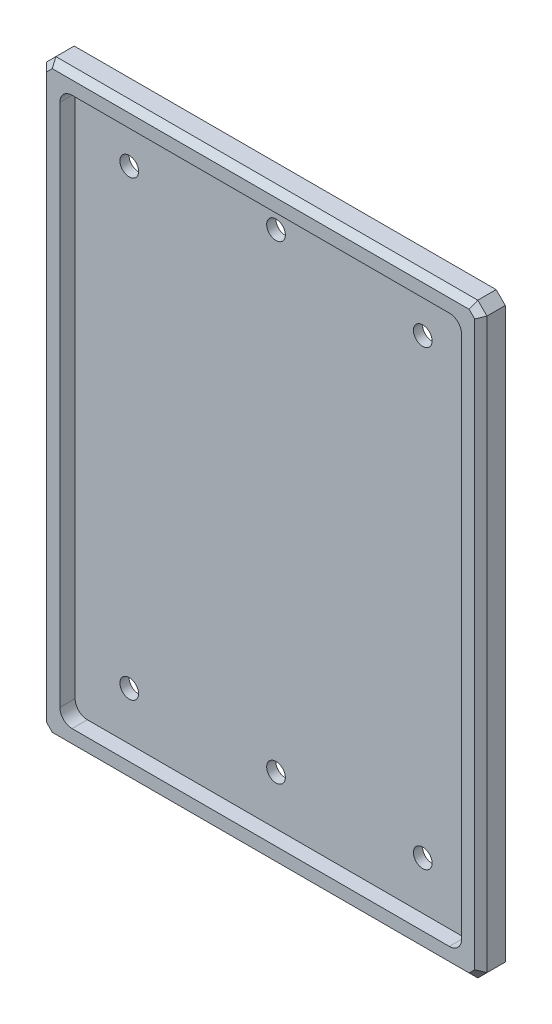
from build123d import *

# Parameters (mm, degrees)
SKETCH1_W                 = 228.6
SKETCH1_H                 = 304.8
BOSS_EXTRUDE1_DEPTH       = 12.7
CUT_EXTRUDE1_DEPTH        = 7.9375
SKETCH4_R                 = 4.85
CUT_EXTRUDE2_DEPTH        = 191.665292873
M4X0_7_TAPPED_HOLE1_D     = 3.3
M4X0_7_TAPPED_HOLE1_DEPTH = 5.4
M4X0_7_TAPPED_HOLE1_TIP   = 0.991420021
CHAMFER1_SIZE             = 4.7625
CHAMFER2_SIZE             = 3.175


with BuildPart() as part:
    # Sketch1 → Boss-Extrude1 (new body)
    with BuildSketch(Plane.XY):
        Rectangle(SKETCH1_W, SKETCH1_H)
    extrude(amount=BOSS_EXTRUDE1_DEPTH)

    # Sketch2 → Cut-Extrude1 (cut)
    with BuildSketch(Plane.XY.offset(12.7)):
        with BuildLine():
            Line((97.95, -142.4), (-97.95, -142.4))
            ThreePointArc((-97.95, -142.4), (-102.440128061, -140.540128061), (-104.3, -136.05))
            Line((-104.3, -136.05), (-104.3, 136.05))
            ThreePointArc((-104.3, 136.05), (-102.440128061, 140.540128061), (-97.95, 142.4))
            Line((-97.95, 142.4), (97.95, 142.4))
            ThreePointArc((97.95, 142.4), (102.440128061, 140.540128061), (104.3, 136.05))
            Line((104.3, 136.05), (104.3, -136.05))
            ThreePointArc((104.3, -136.05), (102.440128061, -140.540128061), (97.95, -142.4))
        make_face()
    extrude(amount=-CUT_EXTRUDE1_DEPTH, mode=Mode.SUBTRACT)

    # Sketch4 → Cut-Extrude2 (cut, through all)
    with BuildSketch(Plane.XY.offset(4.7625)):
        with Locations((-76.2, 117.4)):
            Circle(SKETCH4_R)
        with Locations((76.2, 117.4)):
            Circle(SKETCH4_R)
        with Locations((-76.2, -117.4)):
            Circle(SKETCH4_R)
        with Locations((76.2, -117.4)):
            Circle(SKETCH4_R)
        with Locations((0, 126.925)):
            Circle(SKETCH4_R)
        with Locations((0, -117)):
            Circle(SKETCH4_R)
    extrude(amount=-CUT_EXTRUDE2_DEPTH, mode=Mode.SUBTRACT)

    # M4x0.7 Tapped Hole1
    with Locations(Plane(origin=(0, 0, 0), x_dir=(-1, 0, 0), z_dir=(0, 0, -1))):
        with Locations((-111.125, -102.4), (-111.125, 0), (-111.125, 113.6)):
            Hole(M4X0_7_TAPPED_HOLE1_D / 2, depth=M4X0_7_TAPPED_HOLE1_DEPTH)
            with Locations((0, 0, -(M4X0_7_TAPPED_HOLE1_DEPTH + M4X0_7_TAPPED_HOLE1_TIP / 2))):  # 118° drill point
                Cone(0, M4X0_7_TAPPED_HOLE1_D / 2, M4X0_7_TAPPED_HOLE1_TIP, mode=Mode.SUBTRACT)

    # Chamfer1
    chamfer1_edges = [part.edges().sort_by_distance(p)[0] for p in [
        (-114.3, -152.4, 6.35),
        (114.3, -152.4, 6.35),
        (-114.3, 152.4, 6.35),
        (114.3, 152.4, 6.35),
    ]]
    chamfer(chamfer1_edges, length=CHAMFER1_SIZE)

    # Chamfer2
    chamfer2_edges = [part.edges().sort_by_distance(p)[0] for p in [
        (-111.91875, 150.01875, 12.7),
        (0, 152.4, 12.7),
        (111.91875, 150.01875, 12.7),
        (114.3, 0, 12.7),
        (111.91875, -150.01875, 12.7),
        (0, -152.4, 12.7),
        (-111.91875, -150.01875, 12.7),
        (-114.3, 0, 12.7),
    ]]
    chamfer(chamfer2_edges, length=CHAMFER2_SIZE)


solid = part.part
